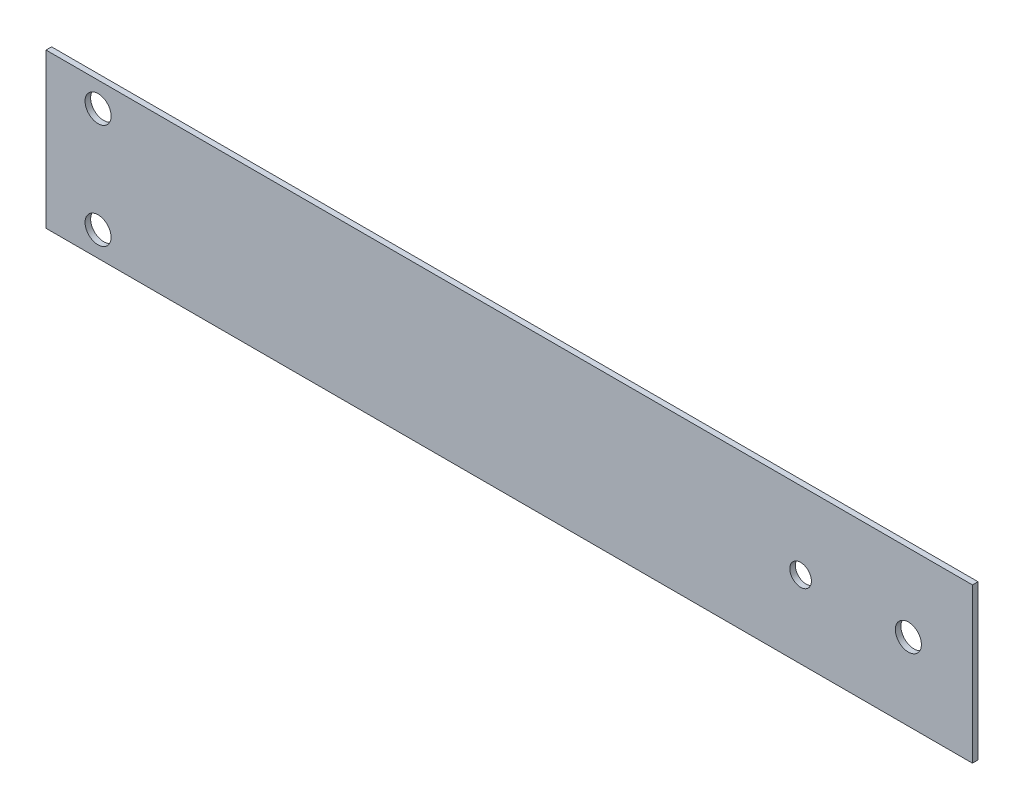
from build123d import *

# Parameters (mm, degrees)
SKETCH2_W                   = 150
SKETCH2_H                   = 25
BASE_FLANGE1_DEPTH          = 0.9
F_19_0_166_DIAMETER_SLOT1_D = 4.2164
F_19_0_166_DIAMETER_SLOT2_D = 4.2164
F_1_0MM_DOWEL_SLOT1_D       = 3.5


# Sheet-metal steps are written as plain solids
with BuildPart() as part:
    # Sketch2 → Base-Flange1 (new body)
    with BuildSketch(Plane.XY):
        Rectangle(SKETCH2_W, SKETCH2_H)
    extrude(amount=-BASE_FLANGE1_DEPTH)

    # #19 (0.166) Diameter Slot1 (through all)
    with Locations(Plane(origin=(0, 0, -0.9), x_dir=(-1, 0, 0), z_dir=(0, 0, -1))):
        with Locations((-64.628032866, 0)):
            Hole(F_19_0_166_DIAMETER_SLOT1_D / 2)

    # #19 (0.166) Diameter Slot2 (through all)
    with Locations(Plane.XY):
        with Locations((-66.567919304, 8.5), (-66.567919304, -8.5)):
            Hole(F_19_0_166_DIAMETER_SLOT2_D / 2)

    # Ø1.0mm Dowel Slot1 (through all)
    with Locations(Plane.XY):
        with Locations((47.178032866, 0)):
            Hole(F_1_0MM_DOWEL_SLOT1_D / 2)


solid = part.part
